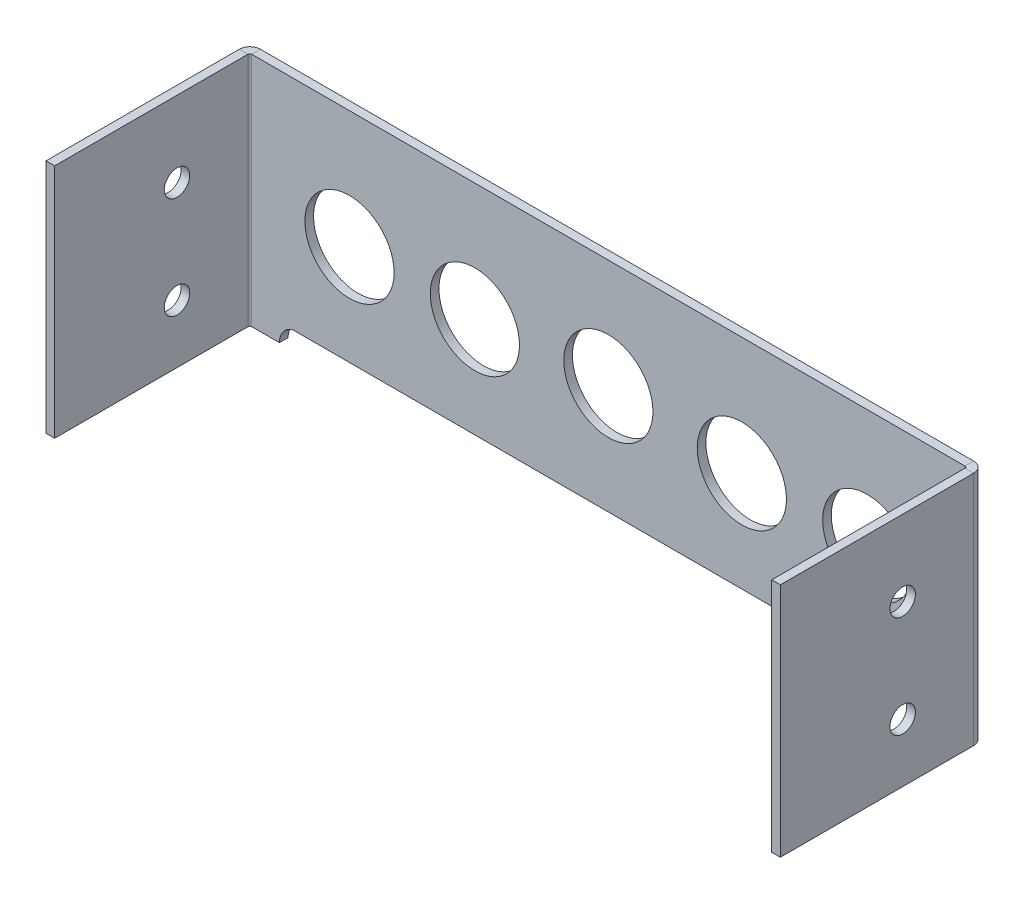
from build123d import *

# Parameters (mm, degrees)
BASE_FLANGE1_START           = -3.4
BASE_FLANGE1_OUTLINE_R       = 17.5
BASE_FLANGE1_DEPTH           = 3.4
EDGE_FLANGE2_STRIP_W         = 15.0732
EDGE_FLANGE2_STRIP_H         = 3.4
EDGE_FLANGE2_STRIP_CUT_DEPTH = 92.6
EDGE_FLANGE2_DEPTH           = 92.6
EDGE_FLANGE2_PROFILE_W       = 92.6
EDGE_FLANGE2_PROFILE_H       = 75.8634
EDGE_FLANGE2_PROFILE_R       = 5
EDGE_FLANGE2_FLAT_DEPTH      = 3.4
EDGE_FLANGE3_STRIP_W         = 15.0732
EDGE_FLANGE3_STRIP_H         = 3.4
EDGE_FLANGE3_STRIP_CUT_DEPTH = 92.6
EDGE_FLANGE3_DEPTH           = 92.6
EDGE_FLANGE3_PROFILE_W       = 92.6
EDGE_FLANGE3_PROFILE_H       = 75.8634
EDGE_FLANGE3_PROFILE_R       = 5
EDGE_FLANGE3_FLAT_DEPTH      = 3.4


# Read off the part's stored shape, not the designer's step: Base-Flange1
# Sheet-metal steps are written as plain solids
with BuildPart() as part:
    # Base-Flange1 outline → Base-Flange1 (new body)
    with BuildSketch(Plane.XY.offset(BASE_FLANGE1_START)):
        with BuildLine():
            Line((0, -92.6), (0, 0))
            Line((0, 0), (-288.2, 0))
            Line((-288.2, 0), (-288.2, -92.6))
            Line((-288.2, -92.6), (-273.2, -92.6))
            ThreePointArc((-273.2, -92.6), (-271.814311921, -88.29213457), (-268.176971207, -85.6))
            Line((-268.176971207, -85.6), (-20.023028793, -85.6))
            ThreePointArc((-20.023028793, -85.6), (-16.385688079, -88.29213457), (-15, -92.6))
            Line((-15, -92.6), (0, -92.6))
        make_face()
        with Locations((-245.7, -46.3)):
            Circle(BASE_FLANGE1_OUTLINE_R, mode=Mode.SUBTRACT)
        with Locations((-196.483203415, -46.3)):
            Circle(BASE_FLANGE1_OUTLINE_R, mode=Mode.SUBTRACT)
        with Locations((-144.1, -42.8)):
            Circle(BASE_FLANGE1_OUTLINE_R, mode=Mode.SUBTRACT)
        with Locations((-91.716796585, -46.3)):
            Circle(BASE_FLANGE1_OUTLINE_R, mode=Mode.SUBTRACT)
        with Locations((-42.5, -46.3)):
            Circle(BASE_FLANGE1_OUTLINE_R, mode=Mode.SUBTRACT)
    extrude(amount=BASE_FLANGE1_DEPTH)

    # Edge-Flange2 strip (across the edge) → Edge-Flange2 strip cut (cut)
    with BuildSketch(Plane(origin=(-288.2, 0, 0), x_dir=(1, 0, 0), z_dir=(0, -1, 0))):
        with Locations((-3.4, -1.7)):
            Rectangle(EDGE_FLANGE2_STRIP_W, EDGE_FLANGE2_STRIP_H)
    extrude(amount=EDGE_FLANGE2_STRIP_CUT_DEPTH, mode=Mode.SUBTRACT)

    # Edge-Flange2 bend section (across the edge) → Edge-Flange2 (add)
    with BuildSketch(Plane(origin=(-288.2, 0, 0), x_dir=(1, 0, 0), z_dir=(0, -1, 0))):
        with BuildLine():
            Line((0, 0.7366), (3.4, 0.7366))
            ThreePointArc((3.4, 0.7366), (3.615745145, 0.215745145), (4.1366, 0))
            Line((4.1366, 0), (4.1366, -3.4))
            ThreePointArc((4.1366, -3.4), (1.211582089, -2.188417911), (0, 0.7366))
        make_face()
    extrude(amount=EDGE_FLANGE2_DEPTH)

    # Edge-Flange2 profile (on flange) → Edge-Flange2 flat (add)
    with BuildSketch(Plane.YZ.offset(-288.2)):
        with Locations((-46.3, 38.6683)):
            Rectangle(EDGE_FLANGE2_PROFILE_W, EDGE_FLANGE2_PROFILE_H)
        with Locations((-29.7, 28.6)):
            Circle(EDGE_FLANGE2_PROFILE_R, mode=Mode.SUBTRACT)
        with Locations((-69.7, 28.6)):
            Circle(EDGE_FLANGE2_PROFILE_R, mode=Mode.SUBTRACT)
    extrude(amount=EDGE_FLANGE2_FLAT_DEPTH)

    # Edge-Flange3 strip (across the edge) → Edge-Flange3 strip cut (cut)
    with BuildSketch(Plane(origin=(0, -92.6, 0), x_dir=(-1, 0, 0), z_dir=(0, 1, 0))):
        with Locations((-3.4, -1.7)):
            Rectangle(EDGE_FLANGE3_STRIP_W, EDGE_FLANGE3_STRIP_H)
    extrude(amount=EDGE_FLANGE3_STRIP_CUT_DEPTH, mode=Mode.SUBTRACT)

    # Edge-Flange3 bend section (across the edge) → Edge-Flange3 (add)
    with BuildSketch(Plane(origin=(0, -92.6, 0), x_dir=(-1, 0, 0), z_dir=(0, 1, 0))):
        with BuildLine():
            Line((0, 0.7366), (3.4, 0.7366))
            ThreePointArc((3.4, 0.7366), (3.615745145, 0.215745145), (4.1366, 0))
            Line((4.1366, 0), (4.1366, -3.4))
            ThreePointArc((4.1366, -3.4), (1.211582089, -2.188417911), (0, 0.7366))
        make_face()
    extrude(amount=EDGE_FLANGE3_DEPTH)

    # Edge-Flange3 profile (on flange) → Edge-Flange3 flat (add)
    with BuildSketch(Plane.YZ):
        with Locations((-46.3, 38.6683)):
            Rectangle(EDGE_FLANGE3_PROFILE_W, EDGE_FLANGE3_PROFILE_H)
        with Locations((-69.7, 28.6)):
            Circle(EDGE_FLANGE3_PROFILE_R, mode=Mode.SUBTRACT)
        with Locations((-29.7, 28.6)):
            Circle(EDGE_FLANGE3_PROFILE_R, mode=Mode.SUBTRACT)
    extrude(amount=-EDGE_FLANGE3_FLAT_DEPTH)


solid = part.part
